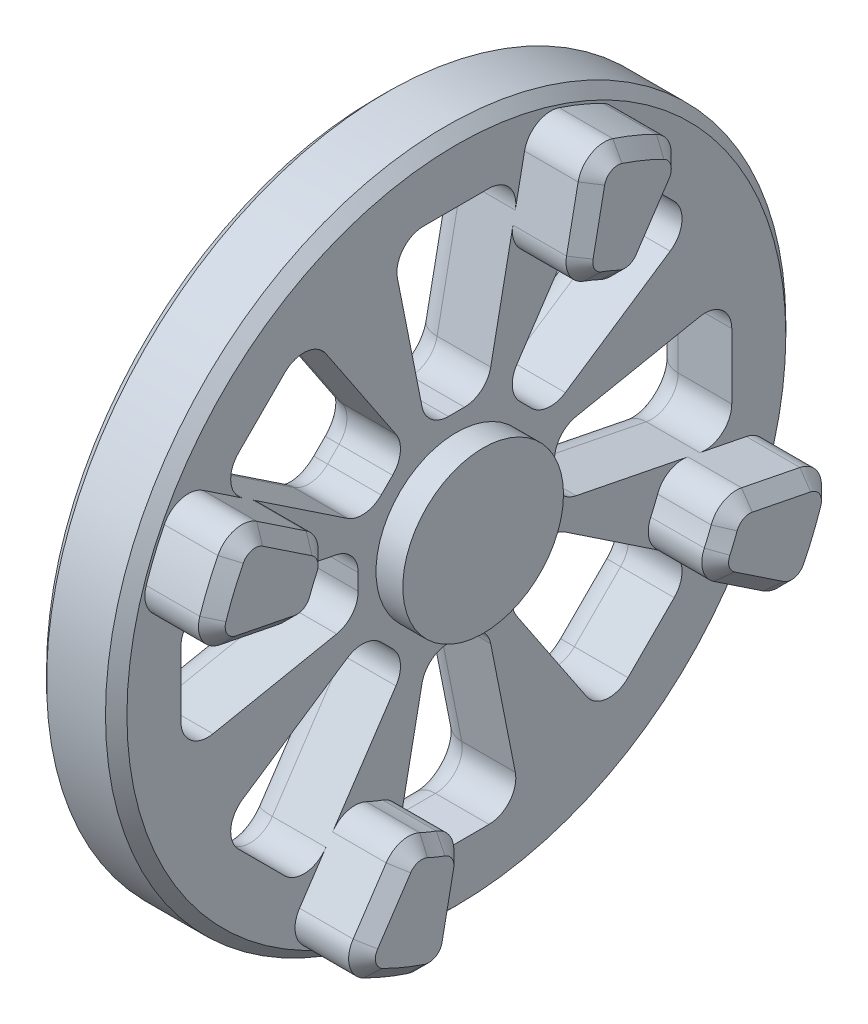
from build123d import *

# Parameters (mm, degrees)
SKETCH2_R                    = 3
BOSS_EXTRUDE1_DEPTH          = 1
SKETCH4_R                    = 12.7
EXTRUDE_432_DEPTH            = 3
CHAMFER2_SIZE                = 0.4
CUT_EXTRUDE6_REACH           = 20.401
CIRPATTERN1_COUNT            = 8
FILLET1_R                    = 1
BOSS_EXTRUDE7_DEPTH          = 2.5
CHAMFER4_SIZE                = 0.5
CIRPATTERN4_COUNT            = 4
CHAMFER4_OF_CIRPATTERN4_SIZE = 0.5


with BuildPart() as part:
    # Sketch2 → Boss-Extrude1 (new body)
    with BuildSketch(Plane(origin=(0, 0, 0), x_dir=(0, 0, -1), z_dir=(1, 0, 0))):
        Circle(SKETCH2_R)
    extrude(amount=-BOSS_EXTRUDE1_DEPTH)

    # Sketch4 → Extrude 432 (add)
    with BuildSketch(Plane.ZY.offset(1)):
        Circle(SKETCH4_R)
    extrude(amount=EXTRUDE_432_DEPTH)

    # Chamfer2
    chamfer2_edges = [part.edges().sort_by_distance(p)[0] for p in [
        (-1, 0, -12.7),
        (-4, 0, -12.7),
    ]]
    chamfer(chamfer2_edges, length=CHAMFER2_SIZE)

    # Sketch6 → Cut-Extrude6 (cut, up to next)
    with BuildSketch(Plane.ZY.offset(4), mode=Mode.PRIVATE) as cut_extrude6_sk1:
        with BuildLine():
            Line((-0.301146321, 3.666270684), (0.301146321, 3.666270684))
            ThreePointArc((0.301146321, 3.666270684), (0.935539605, 3.893260231), (1.281931602, 4.471180362))
            Line((1.281931602, 4.471180362), (2.20002588, 9.086751984))
            ThreePointArc((2.20002588, 9.086751984), (1.992251053, 9.91623559), (1.219240599, 10.281842306))
            Line((1.219240599, 10.281842306), (-1.219240599, 10.281842306))
            ThreePointArc((-1.219240599, 10.281842306), (-1.992251053, 9.91623559), (-2.20002588, 9.086751984))
            Line((-2.20002588, 9.086751984), (-1.281931602, 4.471180362))
            ThreePointArc((-1.281931602, 4.471180362), (-0.935539605, 3.893260231), (-0.301146321, 3.666270684))
        make_face()
    cut_extrude6_tool1 = extrude(cut_extrude6_sk1.sketch, amount=-CUT_EXTRUDE6_REACH, mode=Mode.PRIVATE) & part.part
    cut_extrude6 = cut_extrude6_tool1.solids().sort_by_distance((-4, 7.345701, 0))[0]
    add(cut_extrude6, mode=Mode.SUBTRACT)

    # CirPattern1: Cut-Extrude6 ×8 about axis
    cirpattern1_axis = Axis((0, 0, 0), (1, 0, 0))
    for i in range(1, CIRPATTERN1_COUNT):
        add(cut_extrude6.rotate(cirpattern1_axis, i * 360 / CIRPATTERN1_COUNT), mode=Mode.SUBTRACT)

    # Fillet1
    # the kernel refuses this fillet: 1 mm, written as the material it takes off along each edge
    with BuildSketch(Plane(origin=(-4, -7.425386932, 5.701120341), x_dir=(0, -0.5555702330196015, -0.8314696123025458), z_dir=(0, 0.8314696123025458, -0.5555702330196015))) as fillet1_piece_1:
        with BuildLine():
            CenterArc((1 + FILLET1_R, -FILLET1_R), FILLET1_R, 90, 90)
            Line((1, -FILLET1_R), (1, 0))
            Line((1, 0), (1 + FILLET1_R, 0))
        make_face()
    revolve(axis=Axis((-4, -7.425386932, 5.701120341), (-1, 0, 0)), revolution_arc=101.25, mode=Mode.SUBTRACT)
    with BuildSketch(Plane(origin=(-4, -8.132493713, 6.408227122), x_dir=(0, -0.7071067811865475, 0.7071067811865477), z_dir=(0, 0.7071067811865476, 0.7071067811865475)), Plane(origin=(-4, 1.219240599, -10.281842306), x_dir=(0, 0, -1), z_dir=(0, -1, 0)), Plane(origin=(-4, -6.408227122, -8.132493713), x_dir=(0, -0.7071067811865477, -0.7071067811865475), z_dir=(0, -0.7071067811865475, 0.7071067811865477)), Plane(origin=(-4, 6.408227122, 8.132493713), x_dir=(0, 0.7071067811865476, 0.7071067811865476), z_dir=(0, 0.7071067811865475, -0.7071067811865476)), Plane(origin=(-4, -1.219240599, 10.281842306), x_dir=(0, 0, 1), z_dir=(0, 1, 0)), Plane(origin=(-4, 8.132493713, -6.408227122), x_dir=(0, 0.7071067811865475, -0.7071067811865477), z_dir=(0, -0.7071067811865477, -0.7071067811865474)), Plane(origin=(-4, 10.281842306, 1.219240599), x_dir=(0, 1, 0), z_dir=(0, 0, -1)), Plane(origin=(-4, -10.281842306, -1.219240599), x_dir=(0, -1, 0), z_dir=(0, 0, 1))) as fillet1_piece_2:
        with BuildLine():
            CenterArc((FILLET1_R, FILLET1_R), FILLET1_R, 180, 90)
            Line((0, FILLET1_R), (0, 0))
            Line((0, 0), (FILLET1_R, 0))
        make_face()
    extrude(amount=2.438481198, mode=Mode.SUBTRACT)
    with BuildSketch(Plane(origin=(-4, -5.701120341, 7.425386932), x_dir=(0, -0.7071067811865542, 0.7071067811865409), z_dir=(0, -0.7071067811865409, -0.7071067811865542))) as fillet1_piece_3:
        with BuildLine():
            CenterArc((1 + FILLET1_R, -FILLET1_R), FILLET1_R, 90, 90)
            Line((1, -FILLET1_R), (1, 0))
            Line((1, 0), (1 + FILLET1_R, 0))
        make_face()
    revolve(axis=Axis((-4, -5.701120341, 7.425386932), (-1, 0, 0)), revolution_arc=101.25, mode=Mode.SUBTRACT)
    with BuildSketch(Plane(origin=(-4, -4.869650728, 7.980957165), x_dir=(0, 0.8314696123025415, 0.5555702330196082), z_dir=(0, 0.5555702330196081, -0.8314696123025413)), Plane(origin=(-4, -4.068064482, 2.255139425), x_dir=(0, -0.5555702330196082, -0.8314696123025412), z_dir=(0, -0.8314696123025412, 0.5555702330196082)), Plane(origin=(-4, -2.20002588, -9.086751984), x_dir=(0, -0.9807852804032319, 0.19509032201612156), z_dir=(0, 0.19509032201612156, 0.9807852804032319)), Plane(origin=(-4, 1.281931602, -4.471180362), x_dir=(0, 0.980785280403232, 0.19509032201612111), z_dir=(0, 0.1950903220161211, -0.9807852804032319)), Plane(origin=(-4, -7.980957165, -4.869650728), x_dir=(0, -0.5555702330196081, 0.8314696123025413), z_dir=(0, 0.8314696123025415, 0.555570233019608)), Plane(origin=(-4, -2.255139425, -4.068064482), x_dir=(0, 0.8314696123025412, -0.5555702330196083), z_dir=(0, -0.5555702330196083, -0.8314696123025412)), Plane(origin=(-4, 7.980957165, 4.869650728), x_dir=(0, 0.5555702330196081, -0.8314696123025413), z_dir=(0, -0.8314696123025413, -0.5555702330196081)), Plane(origin=(-4, 2.255139425, 4.068064482), x_dir=(0, -0.8314696123025412, 0.5555702330196082), z_dir=(0, 0.5555702330196082, 0.8314696123025412)), Plane(origin=(-4, 2.20002588, 9.086751984), x_dir=(0, 0.9807852804032319, -0.19509032201612145), z_dir=(0, -0.19509032201612145, -0.9807852804032319)), Plane(origin=(-4, -1.281931602, 4.471180362), x_dir=(0, -0.9807852804032319, -0.19509032201612123), z_dir=(0, -0.1950903220161212, 0.9807852804032319)), Plane(origin=(-4, 4.869650728, -7.980957165), x_dir=(0, -0.8314696123025415, -0.555570233019608), z_dir=(0, -0.555570233019608, 0.8314696123025415)), Plane(origin=(-4, 4.068064482, -2.255139425), x_dir=(0, 0.5555702330196084, 0.8314696123025412), z_dir=(0, 0.8314696123025412, -0.5555702330196084)), Plane(origin=(-4, 9.086751984, -2.20002588), x_dir=(0, -0.19509032201612136, -0.9807852804032319), z_dir=(0, -0.9807852804032319, 0.19509032201612134)), Plane(origin=(-4, 4.471180362, 1.281931602), x_dir=(0, -0.1950903220161213, 0.9807852804032319), z_dir=(0, 0.9807852804032319, 0.1950903220161213)), Plane(origin=(-4, -9.086751984, 2.20002588), x_dir=(0, 0.19509032201612148, 0.9807852804032319), z_dir=(0, 0.9807852804032319, -0.19509032201612145)), Plane(origin=(-4, -4.471180362, -1.281931602), x_dir=(0, 0.19509032201612123, -0.9807852804032319), z_dir=(0, -0.9807852804032319, -0.1950903220161212))) as fillet1_piece_4:
        with BuildLine():
            CenterArc((FILLET1_R, FILLET1_R), FILLET1_R, 180, 90)
            Line((0, FILLET1_R), (0, 0))
            Line((0, 0), (FILLET1_R, 0))
        make_face()
    extrude(amount=4.705996015, mode=Mode.SUBTRACT)
    with BuildSketch(Plane(origin=(-4, -3.086609038, 3.512494249), x_dir=(0, 0.8314696123025379, 0.5555702330196132), z_dir=(0, -0.5555702330196132, 0.8314696123025379))) as fillet1_piece_5:
        with BuildLine():
            CenterArc((1 + FILLET1_R, -FILLET1_R), FILLET1_R, 90, 90)
            Line((1, -FILLET1_R), (1, 0))
            Line((1, 0), (1 + FILLET1_R, 0))
        make_face()
    revolve(axis=Axis((-4, -3.086609038, 3.512494249), (-1, 0, 0)), revolution_arc=78.75, mode=Mode.SUBTRACT)
    with BuildSketch(Plane(origin=(-4, -2.379502257, 2.805387468), x_dir=(0, 0.7071067811865475, -0.7071067811865477), z_dir=(0, -0.7071067811865476, -0.7071067811865475)), Plane(origin=(-4, -0.301146321, -3.666270684), x_dir=(0, 0, 1), z_dir=(0, 1, 0)), Plane(origin=(-4, -2.805387468, -2.379502257), x_dir=(0, 0.7071067811865477, 0.7071067811865475), z_dir=(0, 0.7071067811865475, -0.7071067811865477)), Plane(origin=(-4, 2.805387468, 2.379502257), x_dir=(0, -0.7071067811865477, -0.7071067811865475), z_dir=(0, -0.7071067811865475, 0.7071067811865476)), Plane(origin=(-4, 0.301146321, 3.666270684), x_dir=(0, 0, -1), z_dir=(0, -1, 0)), Plane(origin=(-4, 2.379502257, -2.805387468), x_dir=(0, -0.7071067811865474, 0.7071067811865476), z_dir=(0, 0.7071067811865477, 0.7071067811865474)), Plane(origin=(-4, 3.666270684, -0.301146321), x_dir=(0, -1, 0), z_dir=(0, 0, 1)), Plane(origin=(-4, -3.666270684, 0.301146321), x_dir=(0, 1, 0), z_dir=(0, 0, -1))) as fillet1_piece_6:
        with BuildLine():
            CenterArc((FILLET1_R, FILLET1_R), FILLET1_R, 180, 90)
            Line((0, FILLET1_R), (0, 0))
            Line((0, 0), (FILLET1_R, 0))
        make_face()
    extrude(amount=0.602292642, mode=Mode.SUBTRACT)
    with BuildSketch(Plane(origin=(-4, -3.512494249, 3.086609038), x_dir=(0, 0.7071067811865516, -0.7071067811865436), z_dir=(0, 0.7071067811865436, 0.7071067811865516))) as fillet1_piece_7:
        with BuildLine():
            CenterArc((1 + FILLET1_R, -FILLET1_R), FILLET1_R, 90, 90)
            Line((1, -FILLET1_R), (1, 0))
            Line((1, 0), (1 + FILLET1_R, 0))
        make_face()
    revolve(axis=Axis((-4, -3.512494249, 3.086609038), (-1, 0, 0)), revolution_arc=78.75, mode=Mode.SUBTRACT)
    with BuildSketch(Plane(origin=(-4, 1.219240599, -9.281842306), x_dir=(0, 0.9807852804032302, 0.19509032201612966), z_dir=(0, -0.19509032201612966, 0.9807852804032302))) as fillet1_piece_8:
        with BuildLine():
            CenterArc((1 + FILLET1_R, -FILLET1_R), FILLET1_R, 90, 90)
            Line((1, -FILLET1_R), (1, 0))
            Line((1, 0), (1 + FILLET1_R, 0))
        make_face()
    revolve(axis=Axis((-4, 1.219240599, -9.281842306), (-1, 0, 0)), revolution_arc=101.25, mode=Mode.SUBTRACT)
    with BuildSketch(Plane(origin=(-4, -1.219240599, -9.281842306), x_dir=(0, 0, -1), z_dir=(0, 1, 0))) as fillet1_piece_9:
        with BuildLine():
            CenterArc((1 + FILLET1_R, -FILLET1_R), FILLET1_R, 90, 90)
            Line((1, -FILLET1_R), (1, 0))
            Line((1, 0), (1 + FILLET1_R, 0))
        make_face()
    revolve(axis=Axis((-4, -1.219240599, -9.281842306), (-1, 0, 0)), revolution_arc=101.25, mode=Mode.SUBTRACT)
    with BuildSketch(Plane(origin=(-4, -0.301146321, -4.666270684), x_dir=(0, -0.9807852804032332, 0.19509032201611476), z_dir=(0, -0.19509032201611476, -0.9807852804032332))) as fillet1_piece_10:
        with BuildLine():
            CenterArc((1 + FILLET1_R, -FILLET1_R), FILLET1_R, 90, 90)
            Line((1, -FILLET1_R), (1, 0))
            Line((1, 0), (1 + FILLET1_R, 0))
        make_face()
    revolve(axis=Axis((-4, -0.301146321, -4.666270684), (-1, 0, 0)), revolution_arc=78.75, mode=Mode.SUBTRACT)
    with BuildSketch(Plane(origin=(-4, 0.301146321, -4.666270684), x_dir=(0, 0, 1), z_dir=(0, -1, 0))) as fillet1_piece_11:
        with BuildLine():
            CenterArc((1 + FILLET1_R, -FILLET1_R), FILLET1_R, 90, 90)
            Line((1, -FILLET1_R), (1, 0))
            Line((1, 0), (1 + FILLET1_R, 0))
        make_face()
    revolve(axis=Axis((-4, 0.301146321, -4.666270684), (-1, 0, 0)), revolution_arc=78.75, mode=Mode.SUBTRACT)
    with BuildSketch(Plane(origin=(-4, -5.701120341, -7.425386932), x_dir=(0, 0.8314696123025458, -0.5555702330196015), z_dir=(0, 0.5555702330196015, 0.8314696123025458))) as fillet1_piece_12:
        with BuildLine():
            CenterArc((1 + FILLET1_R, -FILLET1_R), FILLET1_R, 90, 90)
            Line((1, -FILLET1_R), (1, 0))
            Line((1, 0), (1 + FILLET1_R, 0))
        make_face()
    revolve(axis=Axis((-4, -5.701120341, -7.425386932), (-1, 0, 0)), revolution_arc=101.25, mode=Mode.SUBTRACT)
    with BuildSketch(Plane(origin=(-4, -7.425386932, -5.701120341), x_dir=(0, -0.7071067811865414, -0.7071067811865538), z_dir=(0, 0.7071067811865538, -0.7071067811865414))) as fillet1_piece_13:
        with BuildLine():
            CenterArc((1 + FILLET1_R, -FILLET1_R), FILLET1_R, 90, 90)
            Line((1, -FILLET1_R), (1, 0))
            Line((1, 0), (1 + FILLET1_R, 0))
        make_face()
    revolve(axis=Axis((-4, -7.425386932, -5.701120341), (-1, 0, 0)), revolution_arc=101.25, mode=Mode.SUBTRACT)
    with BuildSketch(Plane(origin=(-4, -3.512494249, -3.086609038), x_dir=(0, -0.5555702330196138, 0.8314696123025376), z_dir=(0, -0.8314696123025376, -0.5555702330196138))) as fillet1_piece_14:
        with BuildLine():
            CenterArc((1 + FILLET1_R, -FILLET1_R), FILLET1_R, 90, 90)
            Line((1, -FILLET1_R), (1, 0))
            Line((1, 0), (1 + FILLET1_R, 0))
        make_face()
    revolve(axis=Axis((-4, -3.512494249, -3.086609038), (-1, 0, 0)), revolution_arc=78.75, mode=Mode.SUBTRACT)
    with BuildSketch(Plane(origin=(-4, -3.086609038, -3.512494249), x_dir=(0, 0.7071067811865436, 0.7071067811865516), z_dir=(0, -0.7071067811865516, 0.7071067811865436))) as fillet1_piece_15:
        with BuildLine():
            CenterArc((1 + FILLET1_R, -FILLET1_R), FILLET1_R, 90, 90)
            Line((1, -FILLET1_R), (1, 0))
            Line((1, 0), (1 + FILLET1_R, 0))
        make_face()
    revolve(axis=Axis((-4, -3.086609038, -3.512494249), (-1, 0, 0)), revolution_arc=78.75, mode=Mode.SUBTRACT)
    with BuildSketch(Plane(origin=(-4, 5.701120341, 7.425386932), x_dir=(0, -0.8314696123025458, 0.5555702330196015), z_dir=(0, -0.5555702330196015, -0.8314696123025458))) as fillet1_piece_16:
        with BuildLine():
            CenterArc((1 + FILLET1_R, -FILLET1_R), FILLET1_R, 90, 90)
            Line((1, -FILLET1_R), (1, 0))
            Line((1, 0), (1 + FILLET1_R, 0))
        make_face()
    revolve(axis=Axis((-4, 5.701120341, 7.425386932), (-1, 0, 0)), revolution_arc=101.25, mode=Mode.SUBTRACT)
    with BuildSketch(Plane(origin=(-4, 7.425386932, 5.701120341), x_dir=(0, 0.7071067811865405, 0.7071067811865547), z_dir=(0, -0.7071067811865547, 0.7071067811865405))) as fillet1_piece_17:
        with BuildLine():
            CenterArc((1 + FILLET1_R, -FILLET1_R), FILLET1_R, 90, 90)
            Line((1, -FILLET1_R), (1, 0))
            Line((1, 0), (1 + FILLET1_R, 0))
        make_face()
    revolve(axis=Axis((-4, 7.425386932, 5.701120341), (-1, 0, 0)), revolution_arc=101.25, mode=Mode.SUBTRACT)
    with BuildSketch(Plane(origin=(-4, 3.512494249, 3.086609038), x_dir=(0, 0.5555702330196135, -0.8314696123025377), z_dir=(0, 0.8314696123025377, 0.5555702330196135))) as fillet1_piece_18:
        with BuildLine():
            CenterArc((1 + FILLET1_R, -FILLET1_R), FILLET1_R, 90, 90)
            Line((1, -FILLET1_R), (1, 0))
            Line((1, 0), (1 + FILLET1_R, 0))
        make_face()
    revolve(axis=Axis((-4, 3.512494249, 3.086609038), (-1, 0, 0)), revolution_arc=78.75, mode=Mode.SUBTRACT)
    with BuildSketch(Plane(origin=(-4, 3.086609038, 3.512494249), x_dir=(0, -0.7071067811865436, -0.7071067811865516), z_dir=(0, 0.7071067811865516, -0.7071067811865436))) as fillet1_piece_19:
        with BuildLine():
            CenterArc((1 + FILLET1_R, -FILLET1_R), FILLET1_R, 90, 90)
            Line((1, -FILLET1_R), (1, 0))
            Line((1, 0), (1 + FILLET1_R, 0))
        make_face()
    revolve(axis=Axis((-4, 3.086609038, 3.512494249), (-1, 0, 0)), revolution_arc=78.75, mode=Mode.SUBTRACT)
    with BuildSketch(Plane(origin=(-4, -1.219240599, 9.281842306), x_dir=(0, -0.9807852804032302, -0.1950903220161296), z_dir=(0, 0.1950903220161296, -0.9807852804032302))) as fillet1_piece_20:
        with BuildLine():
            CenterArc((1 + FILLET1_R, -FILLET1_R), FILLET1_R, 90, 90)
            Line((1, -FILLET1_R), (1, 0))
            Line((1, 0), (1 + FILLET1_R, 0))
        make_face()
    revolve(axis=Axis((-4, -1.219240599, 9.281842306), (-1, 0, 0)), revolution_arc=101.25, mode=Mode.SUBTRACT)
    with BuildSketch(Plane(origin=(-4, 1.219240599, 9.281842306), x_dir=(0, 0, 1), z_dir=(0, -1, 0))) as fillet1_piece_21:
        with BuildLine():
            CenterArc((1 + FILLET1_R, -FILLET1_R), FILLET1_R, 90, 90)
            Line((1, -FILLET1_R), (1, 0))
            Line((1, 0), (1 + FILLET1_R, 0))
        make_face()
    revolve(axis=Axis((-4, 1.219240599, 9.281842306), (-1, 0, 0)), revolution_arc=101.25, mode=Mode.SUBTRACT)
    with BuildSketch(Plane(origin=(-4, 0.301146321, 4.666270684), x_dir=(0, 0.9807852804032332, -0.1950903220161148), z_dir=(0, 0.1950903220161148, 0.9807852804032332))) as fillet1_piece_22:
        with BuildLine():
            CenterArc((1 + FILLET1_R, -FILLET1_R), FILLET1_R, 90, 90)
            Line((1, -FILLET1_R), (1, 0))
            Line((1, 0), (1 + FILLET1_R, 0))
        make_face()
    revolve(axis=Axis((-4, 0.301146321, 4.666270684), (-1, 0, 0)), revolution_arc=78.75, mode=Mode.SUBTRACT)
    with BuildSketch(Plane(origin=(-4, -0.301146321, 4.666270684), x_dir=(0, 0, -1), z_dir=(0, 1, 0))) as fillet1_piece_23:
        with BuildLine():
            CenterArc((1 + FILLET1_R, -FILLET1_R), FILLET1_R, 90, 90)
            Line((1, -FILLET1_R), (1, 0))
            Line((1, 0), (1 + FILLET1_R, 0))
        make_face()
    revolve(axis=Axis((-4, -0.301146321, 4.666270684), (-1, 0, 0)), revolution_arc=78.75, mode=Mode.SUBTRACT)
    with BuildSketch(Plane(origin=(-4, 7.425386932, -5.701120341), x_dir=(0, 0.5555702330196022, 0.8314696123025453), z_dir=(0, -0.8314696123025453, 0.5555702330196022))) as fillet1_piece_24:
        with BuildLine():
            CenterArc((1 + FILLET1_R, -FILLET1_R), FILLET1_R, 90, 90)
            Line((1, -FILLET1_R), (1, 0))
            Line((1, 0), (1 + FILLET1_R, 0))
        make_face()
    revolve(axis=Axis((-4, 7.425386932, -5.701120341), (-1, 0, 0)), revolution_arc=101.25, mode=Mode.SUBTRACT)
    with BuildSketch(Plane(origin=(-4, 5.701120341, -7.425386932), x_dir=(0, 0.7071067811865533, -0.7071067811865418), z_dir=(0, 0.7071067811865418, 0.7071067811865533))) as fillet1_piece_25:
        with BuildLine():
            CenterArc((1 + FILLET1_R, -FILLET1_R), FILLET1_R, 90, 90)
            Line((1, -FILLET1_R), (1, 0))
            Line((1, 0), (1 + FILLET1_R, 0))
        make_face()
    revolve(axis=Axis((-4, 5.701120341, -7.425386932), (-1, 0, 0)), revolution_arc=101.25, mode=Mode.SUBTRACT)
    with BuildSketch(Plane(origin=(-4, 3.086609038, -3.512494249), x_dir=(0, -0.8314696123025378, -0.5555702330196135), z_dir=(0, 0.5555702330196135, -0.8314696123025378))) as fillet1_piece_26:
        with BuildLine():
            CenterArc((1 + FILLET1_R, -FILLET1_R), FILLET1_R, 90, 90)
            Line((1, -FILLET1_R), (1, 0))
            Line((1, 0), (1 + FILLET1_R, 0))
        make_face()
    revolve(axis=Axis((-4, 3.086609038, -3.512494249), (-1, 0, 0)), revolution_arc=78.75, mode=Mode.SUBTRACT)
    with BuildSketch(Plane(origin=(-4, 3.512494249, -3.086609038), x_dir=(0, -0.7071067811865513, 0.7071067811865438), z_dir=(0, -0.7071067811865438, -0.7071067811865513))) as fillet1_piece_27:
        with BuildLine():
            CenterArc((1 + FILLET1_R, -FILLET1_R), FILLET1_R, 90, 90)
            Line((1, -FILLET1_R), (1, 0))
            Line((1, 0), (1 + FILLET1_R, 0))
        make_face()
    revolve(axis=Axis((-4, 3.512494249, -3.086609038), (-1, 0, 0)), revolution_arc=78.75, mode=Mode.SUBTRACT)
    with BuildSketch(Plane(origin=(-4, 9.281842306, 1.219240599), x_dir=(0, -0.1950903220161296, 0.9807852804032302), z_dir=(0, -0.9807852804032302, -0.1950903220161296))) as fillet1_piece_28:
        with BuildLine():
            CenterArc((1 + FILLET1_R, -FILLET1_R), FILLET1_R, 90, 90)
            Line((1, -FILLET1_R), (1, 0))
            Line((1, 0), (1 + FILLET1_R, 0))
        make_face()
    revolve(axis=Axis((-4, 9.281842306, 1.219240599), (-1, 0, 0)), revolution_arc=101.25, mode=Mode.SUBTRACT)
    with BuildSketch(Plane(origin=(-4, 9.281842306, -1.219240599), x_dir=(0, 1, 0), z_dir=(0, 0, 1))) as fillet1_piece_29:
        with BuildLine():
            CenterArc((1 + FILLET1_R, -FILLET1_R), FILLET1_R, 90, 90)
            Line((1, -FILLET1_R), (1, 0))
            Line((1, 0), (1 + FILLET1_R, 0))
        make_face()
    revolve(axis=Axis((-4, 9.281842306, -1.219240599), (-1, 0, 0)), revolution_arc=101.25, mode=Mode.SUBTRACT)
    with BuildSketch(Plane(origin=(-4, 4.666270684, -0.301146321), x_dir=(0, -0.19509032201611476, -0.9807852804032332), z_dir=(0, 0.9807852804032332, -0.19509032201611476))) as fillet1_piece_30:
        with BuildLine():
            CenterArc((1 + FILLET1_R, -FILLET1_R), FILLET1_R, 90, 90)
            Line((1, -FILLET1_R), (1, 0))
            Line((1, 0), (1 + FILLET1_R, 0))
        make_face()
    revolve(axis=Axis((-4, 4.666270684, -0.301146321), (-1, 0, 0)), revolution_arc=78.75, mode=Mode.SUBTRACT)
    with BuildSketch(Plane(origin=(-4, 4.666270684, 0.301146321), x_dir=(0, -1, 0), z_dir=(0, 0, -1))) as fillet1_piece_31:
        with BuildLine():
            CenterArc((1 + FILLET1_R, -FILLET1_R), FILLET1_R, 90, 90)
            Line((1, -FILLET1_R), (1, 0))
            Line((1, 0), (1 + FILLET1_R, 0))
        make_face()
    revolve(axis=Axis((-4, 4.666270684, 0.301146321), (-1, 0, 0)), revolution_arc=78.75, mode=Mode.SUBTRACT)
    with BuildSketch(Plane(origin=(-4, -9.281842306, -1.219240599), x_dir=(0, 0.1950903220161296, -0.9807852804032302), z_dir=(0, 0.9807852804032302, 0.1950903220161296))) as fillet1_piece_32:
        with BuildLine():
            CenterArc((1 + FILLET1_R, -FILLET1_R), FILLET1_R, 90, 90)
            Line((1, -FILLET1_R), (1, 0))
            Line((1, 0), (1 + FILLET1_R, 0))
        make_face()
    revolve(axis=Axis((-4, -9.281842306, -1.219240599), (-1, 0, 0)), revolution_arc=101.25, mode=Mode.SUBTRACT)
    with BuildSketch(Plane(origin=(-4, -9.281842306, 1.219240599), x_dir=(0, -1, 0), z_dir=(0, 0, -1))) as fillet1_piece_33:
        with BuildLine():
            CenterArc((1 + FILLET1_R, -FILLET1_R), FILLET1_R, 90, 90)
            Line((1, -FILLET1_R), (1, 0))
            Line((1, 0), (1 + FILLET1_R, 0))
        make_face()
    revolve(axis=Axis((-4, -9.281842306, 1.219240599), (-1, 0, 0)), revolution_arc=101.25, mode=Mode.SUBTRACT)
    with BuildSketch(Plane(origin=(-4, -4.666270684, 0.301146321), x_dir=(0, 0.1950903220161148, 0.9807852804032332), z_dir=(0, -0.9807852804032332, 0.1950903220161148))) as fillet1_piece_34:
        with BuildLine():
            CenterArc((1 + FILLET1_R, -FILLET1_R), FILLET1_R, 90, 90)
            Line((1, -FILLET1_R), (1, 0))
            Line((1, 0), (1 + FILLET1_R, 0))
        make_face()
    revolve(axis=Axis((-4, -4.666270684, 0.301146321), (-1, 0, 0)), revolution_arc=78.75, mode=Mode.SUBTRACT)
    with BuildSketch(Plane(origin=(-4, -4.666270684, -0.301146321), x_dir=(0, 1, 0), z_dir=(0, 0, 1))) as fillet1_piece_35:
        with BuildLine():
            CenterArc((1 + FILLET1_R, -FILLET1_R), FILLET1_R, 90, 90)
            Line((1, -FILLET1_R), (1, 0))
            Line((1, 0), (1 + FILLET1_R, 0))
        make_face()
    revolve(axis=Axis((-4, -4.666270684, -0.301146321), (-1, 0, 0)), revolution_arc=78.75, mode=Mode.SUBTRACT)

    # Sketch10 → Boss-Extrude7 (add)
    with BuildSketch(Plane(origin=(-1, 0, 0), x_dir=(0, 0, -1), z_dir=(1, 0, 0))):
        with BuildLine():
            Line((2.545857957, 10.825367246), (2.11251512, 8.646805688))
            ThreePointArc((2.11251512, 8.646805688), (2.221434223, 7.96197118), (2.749600356, 7.512635881))
            ThreePointArc((2.749600356, 7.512635881), (3.061467459, 7.39103626), (3.367974719, 7.256496834))
            ThreePointArc((3.367974719, 7.256496834), (4.05917261, 7.200755016), (4.620441171, 7.607988705))
            Line((4.620441171, 7.607988705), (5.854497163, 9.454884014))
            ThreePointArc((5.854497163, 9.454884014), (5.989843134, 10.265929542), (5.471512153, 10.904244805))
            ThreePointArc((5.471512153, 10.904244805), (4.668737875, 11.271330297), (3.841522098, 11.579408792))
            ThreePointArc((3.841522098, 11.579408792), (3.023649696, 11.494567093), (2.545857957, 10.825367246))
        make_face()
    boss_extrude7 = extrude(amount=BOSS_EXTRUDE7_DEPTH)

    # Chamfer4
    chamfer4_edges = [part.edges().sort_by_distance(p)[0] for p in [
        (1.5, 10.265929542, -5.989843134),
        (1.5, 11.271330297, -4.668737875),
        (1.5, 11.494567093, -3.023649696),
        (1.5, 9.736086467, -2.329186539),
        (1.5, 7.96197118, -2.221434223),
        (1.5, 7.39103626, -3.061467459),
        (1.5, 7.200755016, -4.05917261),
        (1.5, 8.531436359, -5.237469167),
    ]]
    chamfer(chamfer4_edges, length=CHAMFER4_SIZE)

    # CirPattern4: Boss-Extrude7 ×4 about axis
    cirpattern4_axis = Axis((0, 0, 0), (1, 0, 0))
    for i in range(1, CIRPATTERN4_COUNT):
        add(boss_extrude7.rotate(cirpattern4_axis, i * 360 / CIRPATTERN4_COUNT))

    # Chamfer4 of CirPattern4
    chamfer4_of_cirpattern4_edges = [part.edges().sort_by_distance(p)[0] for p in [
        (1.5, 5.989843134, 10.265929542),
        (1.5, 4.668737875, 11.271330297),
        (1.5, 3.023649696, 11.494567093),
        (1.5, 2.329186539, 9.736086467),
        (1.5, 2.221434223, 7.96197118),
        (1.5, 3.061467459, 7.39103626),
        (1.5, 4.05917261, 7.200755016),
        (1.5, 5.237469167, 8.531436359),
        (1.5, -10.265929542, 5.989843134),
        (1.5, -11.271330297, 4.668737875),
        (1.5, -11.494567093, 3.023649696),
        (1.5, -9.736086467, 2.329186539),
        (1.5, -7.96197118, 2.221434223),
        (1.5, -7.39103626, 3.061467459),
        (1.5, -7.200755016, 4.05917261),
        (1.5, -8.531436359, 5.237469167),
        (1.5, -5.989843134, -10.265929542),
        (1.5, -4.668737875, -11.271330297),
        (1.5, -3.023649696, -11.494567093),
        (1.5, -2.329186539, -9.736086467),
        (1.5, -2.221434223, -7.96197118),
        (1.5, -3.061467459, -7.39103626),
        (1.5, -4.05917261, -7.200755016),
        (1.5, -5.237469167, -8.531436359),
    ]]
    chamfer(chamfer4_of_cirpattern4_edges, length=CHAMFER4_OF_CIRPATTERN4_SIZE)


solid = part.part
